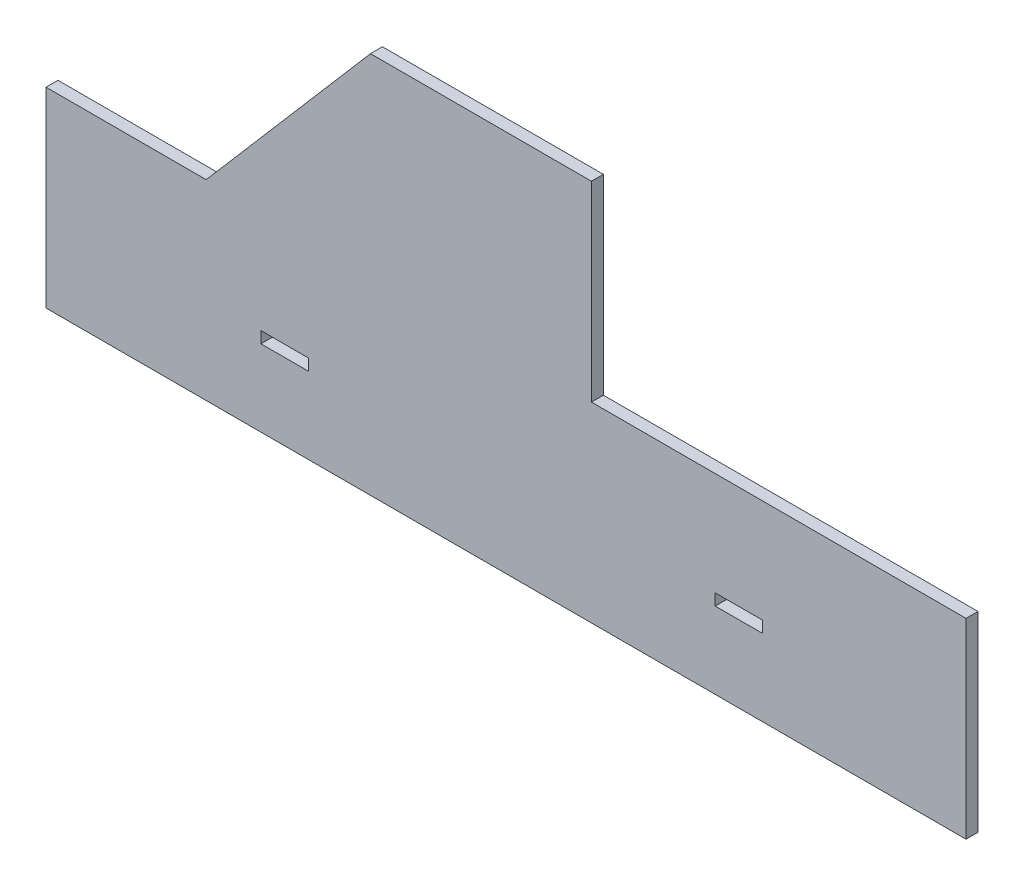
from build123d import *

# Parameters (mm, degrees)
MAIN_SIDE_DEPTH          = 3.175
SKETCH2_W                = 12.573
SKETCH2_H                = 3.048
BOTTOM_PLATE_HOLES_DEPTH = 226.963334319


with BuildPart() as part:
    # Sketch1 → Main Side (new body)
    with BuildSketch(Plane.XY):
        Polygon((0, 0), (201.808790274, 0), (201.808790274, 50.8), (102.314133739, 50.8), (102.314133739, 101.6), (43.639361702, 101.6), (0, 50.8), (-42.539209726, 50.8), (-42.539209726, 0), align=None)
    extrude(amount=MAIN_SIDE_DEPTH)

    # Sketch2 → Bottom Plate Holes (cut, through all)
    with BuildSketch(Plane.XY.offset(3.175)):
        with Locations((141.483790274, 21.844)):
            Rectangle(SKETCH2_W, SKETCH2_H)
        with Locations((20.833790274, 21.844)):
            Rectangle(SKETCH2_W, SKETCH2_H)
    extrude(amount=-BOTTOM_PLATE_HOLES_DEPTH, mode=Mode.SUBTRACT)


solid = part.part
